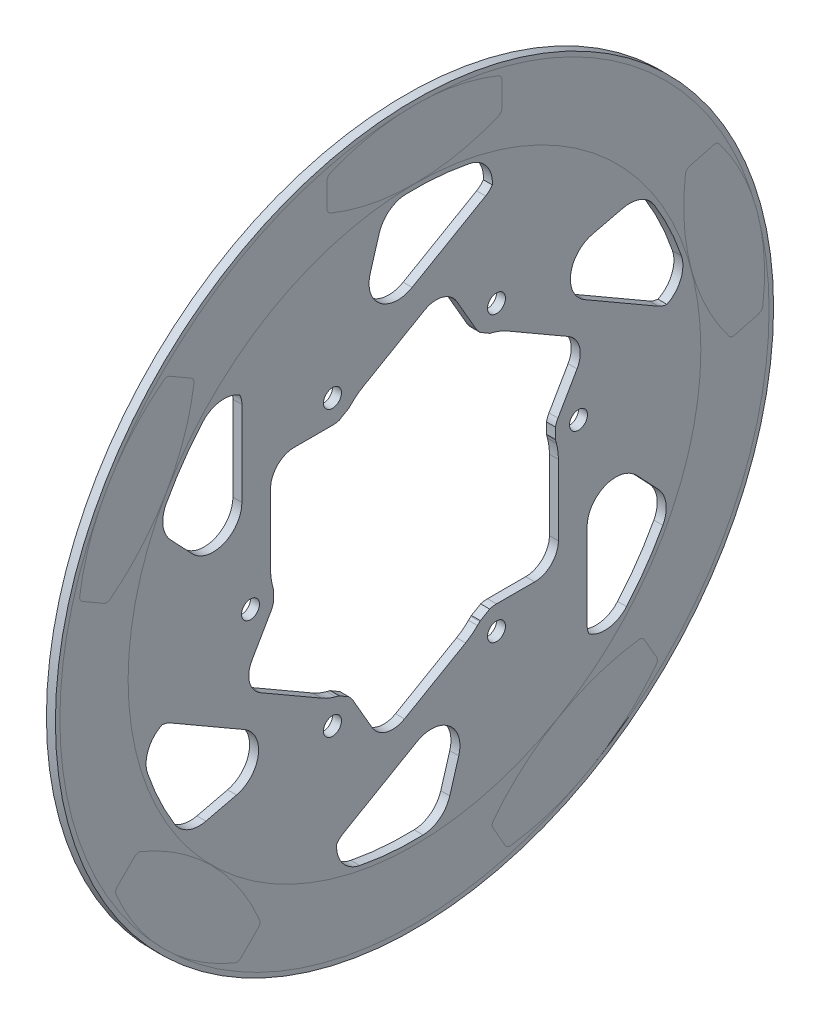
from build123d import *

# Parameters (mm, degrees)
SKETCH1_R           = 127
SKETCH1_R_2         = 3.175
SKETCH1_R_3         = 49.872
BOSS_EXTRUDE1_DEPTH = 3.175
CUT_EXTRUDE9_DEPTH  = 180.63318353
CIRPATTERN1_COUNT   = 6


with BuildPart() as part:
    # Sketch1 → Boss-Extrude1 (new body)
    with BuildSketch(Plane(origin=(0, 0, 0), x_dir=(0, 0, -1), z_dir=(1, 0, 0))):
        Circle(SKETCH1_R)
        with Locations((-29, -50.229473419)):
            Circle(SKETCH1_R_2, mode=Mode.SUBTRACT)
        with Locations((29, -50.229473419)):
            Circle(SKETCH1_R_2, mode=Mode.SUBTRACT)
        with Locations((-58, 0)):
            Circle(SKETCH1_R_2, mode=Mode.SUBTRACT)
        with Locations((-29, 50.229473419)):
            Circle(SKETCH1_R_2, mode=Mode.SUBTRACT)
        Circle(SKETCH1_R_3, mode=Mode.SUBTRACT)
        with Locations((58, 0)):
            Circle(SKETCH1_R_2, mode=Mode.SUBTRACT)
        with Locations((29, 50.229473419)):
            Circle(SKETCH1_R_2, mode=Mode.SUBTRACT)
    extrude(amount=BOSS_EXTRUDE1_DEPTH)

    # Sketch32 → Cut-Extrude9 (cut, through all)
    with BuildSketch(Plane(origin=(3.175, 0, 0), x_dir=(0, 0, -1), z_dir=(1, 0, 0))):
        with BuildLine():
            ThreePointArc((27.539171571, 87.189516845), (25.449429306, 94.026558332), (19.37364654, 97.794452014))
            ThreePointArc((19.37364654, 97.794452014), (9.73332244, 99.218725346), (0, 99.695))
            Line((0, 99.695), (0, 70.49375747))
            Line((0, 70.49375747), (25.141039587, 85.008943443))
            ThreePointArc((25.141039587, 85.008943443), (26.457389868, 85.970244253), (27.539171571, 87.189516845))
        make_face()
        with BuildLine():
            ThreePointArc((86.33840263, 49.8475), (85.56661054, 51.161002587), (84.77483715, 52.462558184))
            ThreePointArc((84.77483715, 52.462558184), (80.009190166, 56.508555927), (73.776901944, 56.998527803))
            Line((73.776901944, 56.998527803), (62.934622723, 54.411007635))
            ThreePointArc((62.934622723, 54.411007635), (55.239212675, 45.993209223), (60.213084079, 35.729717168))
            Line((60.213084079, 35.729717168), (61.049384777, 35.246878735))
            Line((61.049384777, 35.246878735), (86.33840263, 49.8475))
        make_face()
        with BuildLine():
            Line((3.537257742, 60.80423671), (0, 58.762))
            Line((0, 58.762), (0, 49.872))
            ThreePointArc((0, 49.872), (11.988380081, 48.409659439), (23.273716592, 44.108394892))
            ThreePointArc((23.273716592, 44.108394892), (22.436018056, 45.016790326), (21.740975065, 46.038473419))
            Line((21.740975065, 46.038473419), (14.987282677, 57.736211775))
            ThreePointArc((14.987282677, 57.736211775), (9.897678978, 61.641602051), (3.537257742, 60.80423671))
        make_face()
        with BuildLine():
            Line((43.190418938, 24.936), (50.889384777, 29.381))
            Line((50.889384777, 29.381), (32.826314105, 39.809718715))
            ThreePointArc((32.826314105, 39.809718715), (30.442441451, 40.985314611), (27.925517102, 41.8396953))
            Line((27.925517102, 41.8396953), (26.830578764, 42.133083144))
            ThreePointArc((26.830578764, 42.133083144), (26.696035921, 42.170337391), (26.562132201, 42.209827256))
            ThreePointArc((26.562132201, 42.209827256), (35.929804823, 34.58707142), (43.190418938, 24.936))
        make_face()
    cut_extrude9 = extrude(amount=-CUT_EXTRUDE9_DEPTH, mode=Mode.SUBTRACT)

    # CirPattern1: Cut-Extrude9 ×6 about axis
    cirpattern1_axis = Axis((3.175, 0, 0), (-1, 0, 0))
    for i in range(1, CIRPATTERN1_COUNT):
        add(cut_extrude9.rotate(cirpattern1_axis, i * 360 / CIRPATTERN1_COUNT), mode=Mode.SUBTRACT)


solid = part.part
